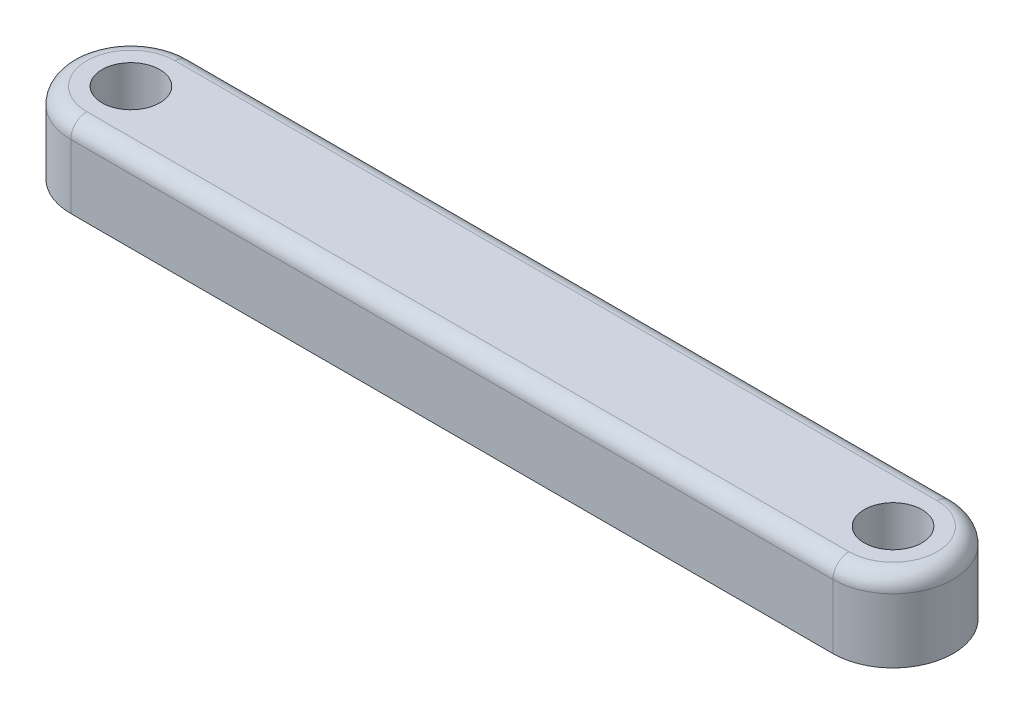
from build123d import *

# Parameters (mm, degrees)
SKETCH1_R           = 2.286
BOSS_EXTRUDE1_DEPTH = 6.35
FILLET1_R           = 1.27


with BuildPart() as part:
    # Sketch1 → Boss-Extrude1 (new body)
    with BuildSketch(Plane(origin=(0, 0, 0), x_dir=(1, 0, 0), z_dir=(0, 1, 0))):
        with BuildLine():
            Line((0, -4.7625), (-60.325, -4.7625))
            ThreePointArc((-60.325, -4.7625), (-65.0875, 0), (-60.325, 4.7625))
            Line((-60.325, 4.7625), (0, 4.7625))
            ThreePointArc((0, 4.7625), (4.7625, 0), (0, -4.7625))
        make_face()
        with Locations((-60.325, 0)):
            Circle(SKETCH1_R, mode=Mode.SUBTRACT)
        Circle(SKETCH1_R, mode=Mode.SUBTRACT)
    extrude(amount=BOSS_EXTRUDE1_DEPTH)

    # Fillet1
    fillet1_edges = [part.edges().sort_by_distance(p)[0] for p in [
        (4.7625, 6.35, 0),
        (-30.1625, 6.35, 4.7625),
        (-65.0875, 6.35, 0),
        (-30.1625, 6.35, -4.7625),
    ]]
    fillet(fillet1_edges, radius=FILLET1_R)


solid = part.part
